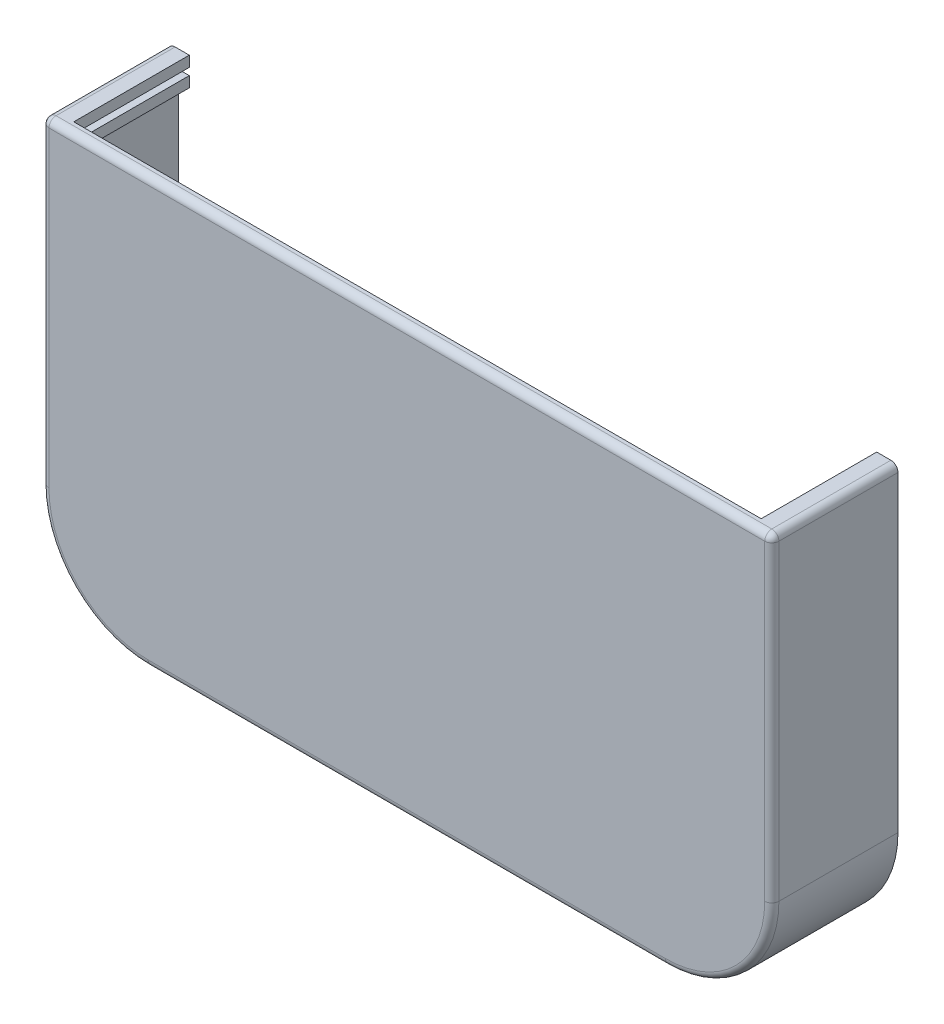
from build123d import *

# Parameters (mm, degrees)
BOSS_EXTRU_1_DEPTH      = 17.8
ENL_V_MAT_EXTRU_1_DEPTH = 16.3
COQUE2_DEPTH            = 16.3
ESQUISSE3_W             = 97
ESQUISSE3_H             = 1.5
ENL_V_MAT_EXTRU_2_DEPTH = 16.3
ESQUISSE4_R             = 2.75
BOSS_EXTRU_2_DEPTH      = 16.3
CONG_3_R                = 2.5
ESQUISSE5_R             = 1
ENL_V_MAT_EXTRU_3_DEPTH = 5
BOSS_EXTRU_4_START      = 16.3
BOSS_EXTRU_4_DEPTH      = 16.3
CONG_4_R                = 1
ESQUISSE8_R             = 1
BOSS_EXTRU_5_DEPTH      = 3
CONG_5_R                = 0.5
CONG_6_R                = 1


# Read off the part's stored shape, not the designer's step: Coque2
with BuildPart() as part:
    # Esquisse1 → Boss.-Extru.1 (new body)
    with BuildSketch(Plane.XY):
        with BuildLine():
            Line((-36.5, -30), (36.5, -30))
            ThreePointArc((36.5, -30), (47.106601718, -25.606601718), (51.5, -15))
            Line((51.5, -15), (51.5, 30))
            Line((51.5, 30), (-51.5, 30))
            Line((-51.5, 30), (-51.5, -15))
            ThreePointArc((-51.5, -15), (-47.106601718, -25.606601718), (-36.5, -30))
        make_face()
    extrude(amount=BOSS_EXTRU_1_DEPTH)

    # Esquisse2 → Enlèv. mat.-Extru.1 (cut)
    with BuildSketch(Plane(origin=(0, 0, 0), x_dir=(-1, 0, 0), z_dir=(0, 0, -1))):
        Polygon((-50, 28.5), (-48.5, 28.5), (-48.5, 30), (48.5, 30), (48.5, 28.5), (50, 28.5), (50, 27.5), (-50, 27.5), align=None)
    extrude(amount=-ENL_V_MAT_EXTRU_1_DEPTH, mode=Mode.SUBTRACT)

    # Coque2 outline → Coque2 (cut)
    with BuildSketch(Plane.XY):
        with BuildLine():
            Line((50, -15), (50, 26))
            Line((50, 26), (-50, 26))
            Line((-50, 26), (-50, -15))
            ThreePointArc((-50, -15), (-46.045941546, -24.545941546), (-36.5, -28.5))
            Line((-36.5, -28.5), (36.5, -28.5))
            ThreePointArc((36.5, -28.5), (46.045941546, -24.545941546), (50, -15))
        make_face()
    extrude(amount=COQUE2_DEPTH, mode=Mode.SUBTRACT)

    # Esquisse3 → Enlèv. mat.-Extru.2 (cut)
    with BuildSketch(Plane(origin=(0, 0, 0), x_dir=(-1, 0, 0), z_dir=(0, 0, -1))):
        with Locations((0, 26.75)):
            Rectangle(ESQUISSE3_W, ESQUISSE3_H)
    extrude(amount=-ENL_V_MAT_EXTRU_2_DEPTH, mode=Mode.SUBTRACT)

    # Esquisse4 → Boss.-Extru.2 (add)
    with BuildSketch(Plane(origin=(0, 0, 16.3), x_dir=(-1, 0, 0), z_dir=(0, 0, -1))):
        Circle(ESQUISSE4_R)
    extrude(amount=BOSS_EXTRU_2_DEPTH)

    # Congé3
    cong_3_edges = [part.edges().sort_by_distance(p)[0] for p in [
        (2.75, 0, 16.3),
    ]]
    fillet(cong_3_edges, radius=CONG_3_R)

    # Esquisse5 → Enlèv. mat.-Extru.3 (cut)
    with BuildSketch(Plane(origin=(0, 0, 0), x_dir=(-1, 0, 0), z_dir=(0, 0, -1))):
        Circle(ESQUISSE5_R)
    extrude(amount=-ENL_V_MAT_EXTRU_3_DEPTH, mode=Mode.SUBTRACT)

    # Esquisse7 → Boss.-Extru.4 (add)
    with BuildSketch(Plane(origin=(0, 0, 16.3), x_dir=(-1, 0, 0), z_dir=(0, 0, -1)).offset(BOSS_EXTRU_4_START)):
        with BuildLine():
            Line((-50, -15), (-36.5, -28.5))
            ThreePointArc((-36.5, -28.5), (-46.045941546, -24.545941546), (-50, -15))
        make_face()
        with BuildLine():
            Line((36.5, -28.5), (50, -15))
            ThreePointArc((50, -15), (46.045941546, -24.545941546), (36.5, -28.5))
        make_face()
    extrude(amount=-BOSS_EXTRU_4_DEPTH)

    # Congé4
    cong_4_edges = [part.edges().sort_by_distance(p)[0] for p in [
        (43.25, -21.75, 16.3),
        (-43.25, -21.75, 16.3),
        (50, 26, 8.15),
        (50, -15, 8.15),
        (-50, -15, 8.15),
        (-36.5, -28.5, 8.15),
        (36.5, -28.5, 8.15),
        (-50, 5.5, 16.3),
        (0, -28.5, 16.3),
        (50, 5.5, 16.3),
        (-50, 26, 8.15),
        (-49.25, 26, 16.3),
        (49.25, 26, 16.3),
        (48.5, 26.75, 16.3),
        (-48.5, 26.75, 16.3),
    ]]
    fillet(cong_4_edges, radius=CONG_4_R)

    # Esquisse8 → Boss.-Extru.5 (add)
    with BuildSketch(Plane(origin=(0, 0, 0), x_dir=(-1, 0, 0), z_dir=(0, 0, -1))):
        with Locations((-45, -23.5)):
            Circle(ESQUISSE8_R)
        with Locations(Location((45, -23.5, 0), (0, 0, 180))):
            Circle(ESQUISSE8_R)
    extrude(amount=BOSS_EXTRU_5_DEPTH)

    # Congé5
    cong_5_edges = [part.edges().sort_by_distance(p)[0] for p in [
        (46, -23.5, 0),
        (46, -23.5, -3),
        (-46, -23.5, 0),
        (-46, -23.5, -3),
    ]]
    fillet(cong_5_edges, radius=CONG_5_R)

    # Congé6
    cong_6_edges = [part.edges().sort_by_distance(p)[0] for p in [
        (-51.5, 7.5, 17.8),
        (-51.5, 30, 8.9),
        (51.5, 30, 8.9),
        (-47.106601718, -25.606601718, 17.8),
        (0, -30, 17.8),
        (47.106601718, -25.606601718, 17.8),
        (51.5, 7.5, 17.8),
        (0, 30, 17.8),
    ]]
    fillet(cong_6_edges, radius=CONG_6_R)


solid = part.part
